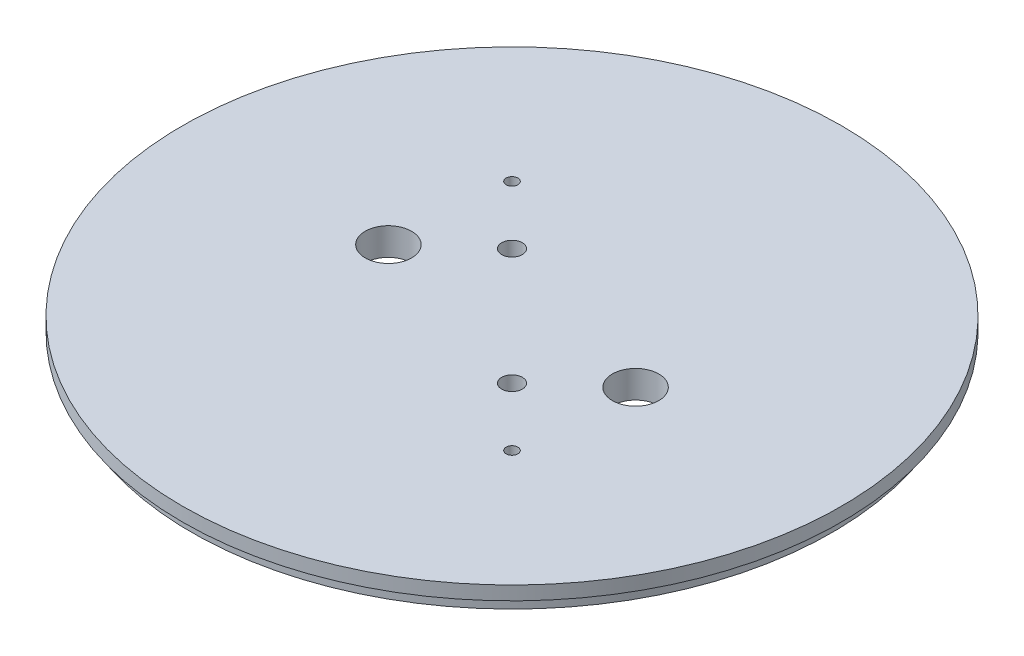
from build123d import *

# Parameters (mm, degrees)
SKETCH1_R           = 76.2
SKETCH1_R_2         = 5.3578125
SKETCH1_R_3         = 1.3589
SKETCH1_R_4         = 2.38125
BOSS_EXTRUDE1_DEPTH = 6.35
SKETCH2_R           = 76.2
SKETCH2_R_2         = 74.041
CUT_EXTRUDE1_DEPTH  = 3.175
CUT_EXTRUDE2_START  = -5.969
CUT_EXTRUDE2_DEPTH  = 3.556


with BuildPart() as part:
    # Sketch1 → Boss-Extrude1 (new body)
    with BuildSketch(Plane(origin=(0, 0, 0), x_dir=(1, 0, 0), z_dir=(0, 1, 0))):
        Circle(SKETCH1_R)
        with Locations((28.575, 0)):
            Circle(SKETCH1_R_2, mode=Mode.SUBTRACT)
        with Locations((-28.575, 0)):
            Circle(SKETCH1_R_2, mode=Mode.SUBTRACT)
        with Locations((-26.940768363, 26.940768363)):
            Circle(SKETCH1_R_3, mode=Mode.SUBTRACT)
        with Locations((26.940768363, -26.940768363)):
            Circle(SKETCH1_R_3, mode=Mode.SUBTRACT)
        with Locations((-13.470384182, 13.470384182)):
            Circle(SKETCH1_R_4, mode=Mode.SUBTRACT)
        with Locations((13.470384182, -13.470384182)):
            Circle(SKETCH1_R_4, mode=Mode.SUBTRACT)
    extrude(amount=BOSS_EXTRUDE1_DEPTH)

    # Sketch2 → Cut-Extrude1 (cut)
    with BuildSketch(Plane.XZ):
        Circle(SKETCH2_R)
        Circle(SKETCH2_R_2, mode=Mode.SUBTRACT)
    extrude(amount=-CUT_EXTRUDE1_DEPTH, mode=Mode.SUBTRACT)

    # Sketch3 → Cut-Extrude2 (cut)
    with BuildSketch(Plane(origin=(0, 6.35, 0), x_dir=(1, 0, 0), z_dir=(0, 1, 0)).offset(CUT_EXTRUDE2_START)):
        with BuildLine():
            Line((3.2385, 34.798), (3.2385, 13.97))
            ThreePointArc((3.2385, 13.97), (0, 10.7315), (-3.2385, 13.97))
            Line((-3.2385, 13.97), (-3.2385, 34.798))
            ThreePointArc((-3.2385, 34.798), (0, 38.0365), (3.2385, 34.798))
        make_face()
        with BuildLine():
            Line((3.2385, -34.798), (3.2385, -13.97))
            ThreePointArc((3.2385, -13.97), (0, -10.7315), (-3.2385, -13.97))
            Line((-3.2385, -13.97), (-3.2385, -34.798))
            ThreePointArc((-3.2385, -34.798), (0, -38.0365), (3.2385, -34.798))
        make_face()
    extrude(amount=-CUT_EXTRUDE2_DEPTH, mode=Mode.SUBTRACT)


solid = part.part
